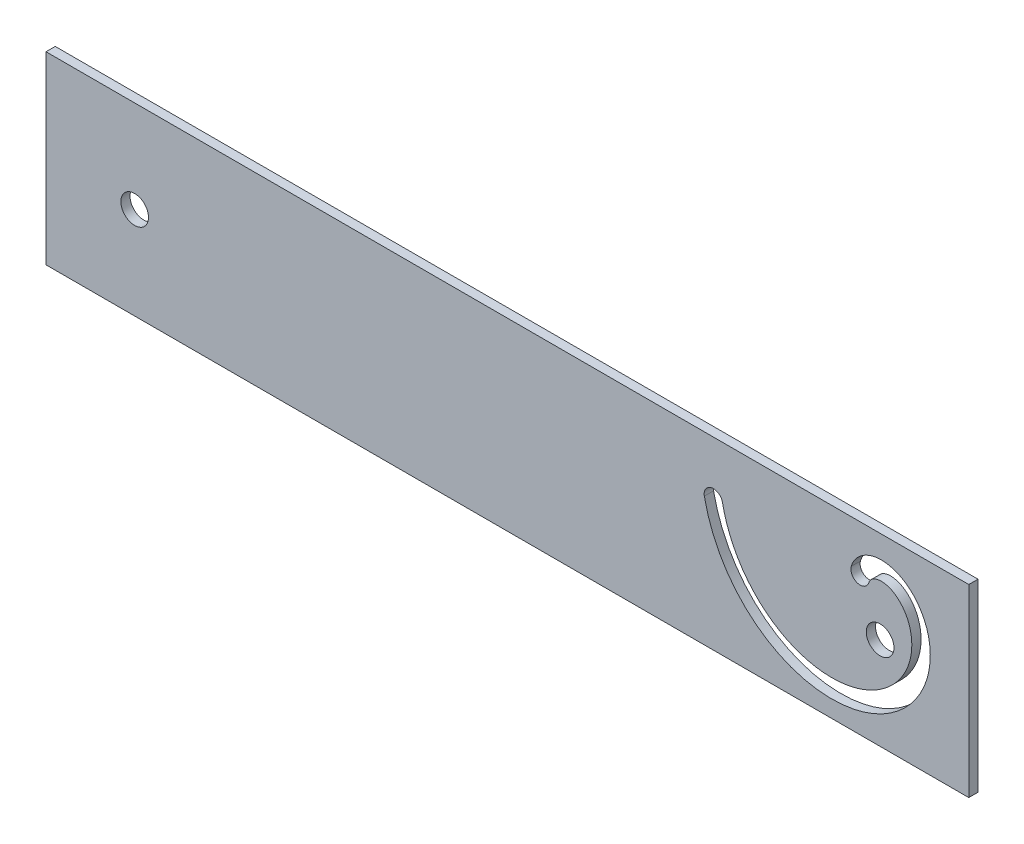
from build123d import *

# Parameters (mm, degrees)
EXTRUDE_1_DEPTH      = 0.5
EXTRUDE_1_DEPTH_BACK = 0.5
SKETCH_1_W           = 100
SKETCH_1_H           = 20
CUT_EXTRUDE_1_DEPTH  = 52
SKETCH_8_R           = 1.5
CUT_EXTRUDE_2_DEPTH  = 52.00000012
SKETCH_9_R           = 1.05
EXTRUDE_2_DEPTH      = 2
OTHER_START          = -2.5
OTHER_2_OUTLINE_R    = 1.05
OTHER_2_DEPTH        = 2


# Read off the part's stored shape, not the designer's step: Пересечение2
with BuildPart() as part:
    # Эскиз1 → Бобышка-Вытянуть1 (new, two sides: drawn at the far end of the back side and taken through both)
    with BuildSketch(Plane.XY.offset(-EXTRUDE_1_DEPTH_BACK)):
        Rectangle(SKETCH_1_W, SKETCH_1_H)
    extrude(amount=EXTRUDE_1_DEPTH + EXTRUDE_1_DEPTH_BACK)

    # Эскиз7 → Вырез-Вытянуть1 (cut, through all)
    with BuildSketch(Plane.XY.offset(0.5)):
        with BuildLine():
            ThreePointArc((37.261495637, 5.33423095), (37.952030231, 4.100066466), (39.186194715, 4.79060106))
            add(Edge.make_bspline(
                [(39.186194715, 4.79060106), (39.206075717, 4.860988923), (39.262496645, 4.988405972), (39.480772307, 5.263607744), (39.972116976, 5.552949613), (40.89012751, 5.611168859), (42.346211172, 5.064723366), (44.026902125, 2.933159087), (43.815557835, -1.408653234), (40.817030581, -4.80884968), (37.021062322, -6.164885186), (33.732157303, -6.253240822), (30.314099065, -5.243442536), (27.144697082, -3.082909818), (25.035720973, -0.378766084), (23.85308145, 2.208270108), (23.449186454, 3.64108751), (23.305322842, 4.359662985)],
                knots=[0, 0, 0, 0, 0.03125, 0.0625, 0.125, 0.1875, 0.25, 0.375, 0.5, 0.625, 0.6875, 0.75, 0.8125, 0.875, 0.9375, 0.96875, 1, 1, 1, 1], degree=3))
            ThreePointArc((23.305322842, 4.359662985), (22.128470162, 5.143893671), (21.344239476, 3.96704099))
            add(Edge.make_bspline(
                [(37.261495637, 5.33423095), (37.539855307, 6.319751815), (39.275153501, 7.946538331), (43.246471825, 7.317604488), (46.129826318, 3.464099405), (45.771597181, -2.30217859), (41.988507816, -6.528062966), (37.380831362, -8.166298308), (33.454677533, -8.267248255), (29.431863805, -7.074452826), (25.746418814, -4.55740521), (23.320064013, -1.441995451), (21.967408891, 1.518598896), (21.5081203, 3.148482776), (21.344239476, 3.96704099)],
                knots=[0, 0, 0, 0, 0.125, 0.25, 0.375, 0.5, 0.625, 0.6875, 0.75, 0.8125, 0.875, 0.9375, 0.96875, 1, 1, 1, 1], degree=3))
        make_face()
    extrude(amount=-CUT_EXTRUDE_1_DEPTH, mode=Mode.SUBTRACT)

    # Эскиз8 → Вырез-Вытянуть2 (cut, through all)
    with BuildSketch(Plane(origin=(0, 0, -0.5), x_dir=(-1, 0, 0), z_dir=(0, 0, -1))):
        with Locations((-40.392058098, 0)):
            Circle(SKETCH_8_R)
    cut_extrude_2 = extrude(amount=-CUT_EXTRUDE_2_DEPTH, mode=Mode.SUBTRACT)

    # Зеркальное отражение1: Вырез-Вытянуть2 across plane
    add(cut_extrude_2.mirror(Plane(origin=(0, 0, 0), x_dir=(0, 0, 1), z_dir=(1, 0, 0))), mode=Mode.SUBTRACT)


with BuildPart() as body_2:
    # Эскиз9 → Бобышка-Вытянуть2 (new body)
    with BuildSketch(Plane(origin=(0, 0, -0.5), x_dir=(-1, 0, 0), z_dir=(0, 0, -1))):
        with BuildLine():
            Line((-38.223845176, 7.062416005), (-136.223845176, 7.062416005))
            Line((-136.223845176, 7.062416005), (-136.223845176, 3.062416005))
            Line((-136.223845176, 3.062416005), (-38.223845176, 3.062416005))
            ThreePointArc((-38.223845176, 3.062416005), (-36.223845176, 5.062416005), (-38.223845176, 7.062416005))
        make_face()
        with Locations((-38.223845176, 5.062416005)):
            Circle(SKETCH_9_R, mode=Mode.SUBTRACT)
    extrude(amount=EXTRUDE_2_DEPTH)

    # Пересечение2 outline → Пересечение2 (cut)
    with BuildSketch(Plane.XY.offset(OTHER_START)):
        with BuildLine():
            Line((136.223845176, 7.062416005), (38.223845176, 7.062416005))
            ThreePointArc((38.223845176, 7.062416005), (36.223845176, 5.062416005), (38.223845176, 3.062416005))
            Line((38.223845176, 3.062416005), (136.223845176, 3.062416005))
            Line((136.223845176, 3.062416005), (136.223845176, 7.062416005))
        make_face()
        with Locations((38.223845176, 5.062416005)):
            Circle(OTHER_2_OUTLINE_R, mode=Mode.SUBTRACT)
    extrude(amount=OTHER_2_DEPTH, mode=Mode.SUBTRACT)


solid = part.part
